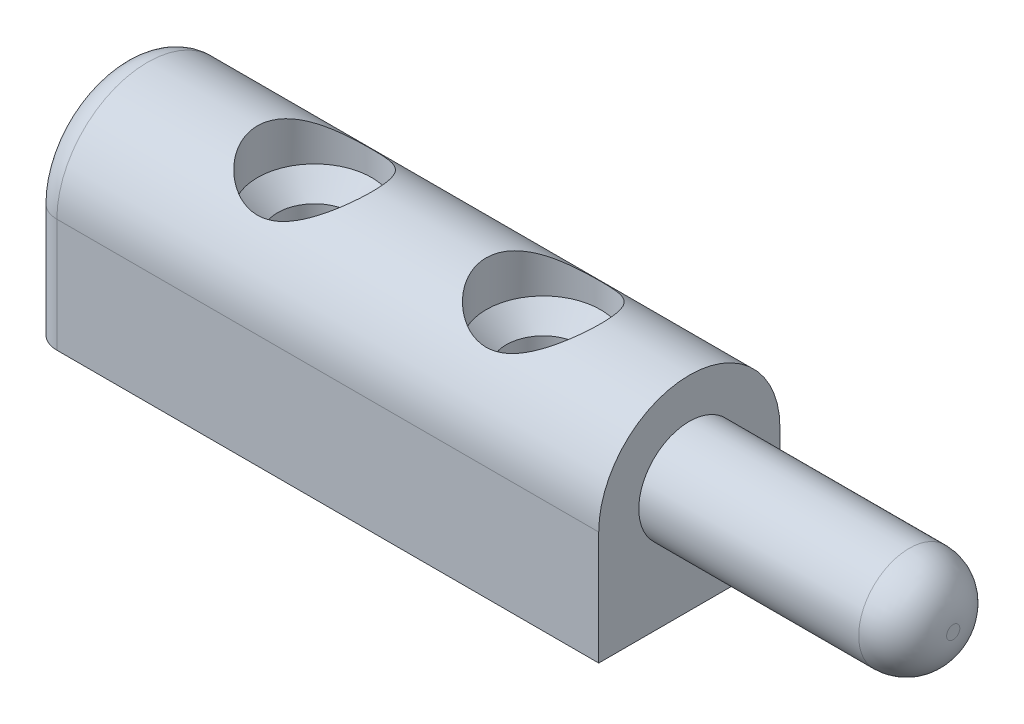
from build123d import *

# Parameters (mm, degrees)
ESBO_O1_R                = 2.95
RESSALTO_EXTRUS_O1_DEPTH = 16.15
RESSALTO_EXTRUS_O2_DEPTH = 32.3
FILETE1_R                = 1.5
ESBO_O3_R                = 3.25
CORTE_EXTRUS_O1_DEPTH    = 21.540435635
ESBO_O5_R                = 3.25
ESBO_O5_R_2              = 2.1
RESSALTO_EXTRUS_O3_DEPTH = 9.1
CHANFRO1_SIZE            = 1.2
ESBO_O7_R                = 2.875
RESSALTO_EXTRUS_O6_DEPTH = 15
FILETE2_R                = 2.5


with BuildPart() as part:
    # Esboço1 → Ressalto-extrusão1 (new, symmetric)
    with BuildSketch(Plane(origin=(0, 0, 0), x_dir=(0, 0, -1), z_dir=(1, 0, 0))):
        with BuildLine():
            Line((5.15, -6.450193796), (-5.15, -6.450193796))
            Line((-5.15, -6.450193796), (-5.15, 0))
            ThreePointArc((-5.15, 0), (0, 5.15), (5.15, 0))
            Line((5.15, 0), (5.15, -6.450193796))
        make_face()
        Circle(ESBO_O1_R, mode=Mode.SUBTRACT)
    extrude(amount=RESSALTO_EXTRUS_O1_DEPTH, both=True)

    # Esboço2 → Ressalto-extrusão2 (add, through all)
    with BuildSketch(Plane.ZY.offset(16.15)):
        with BuildLine():
            Line((-5.15, 0), (-5.15, -6.450193796))
            Line((-5.15, -6.450193796), (5.15, -6.450193796))
            Line((5.15, -6.450193796), (5.15, 0))
            ThreePointArc((5.15, 0), (0, 5.15), (-5.15, 0))
        make_face()
    extrude(amount=-RESSALTO_EXTRUS_O2_DEPTH)

    # Filete1
    filete1_edges = [part.edges().sort_by_distance(p)[0] for p in [
        (-16.15, -3.225096898, -5.15),
        (-16.15, -3.225096898, 5.15),
        (-16.15, 5.15, 0),
    ]]
    fillet(filete1_edges, radius=FILETE1_R)

    # Esboço3 → Corte-extrusão1 (cut, through all)
    with BuildSketch(Plane.XZ.offset(6.450193796)):
        with Locations(Location((-5.15, 0, 0), (0, 0, 270))):
            Circle(ESBO_O3_R)
        with Locations(Location((7.85, 0, 0), (0, 0, 270))):
            Circle(ESBO_O3_R)
    extrude(amount=-CORTE_EXTRUS_O1_DEPTH, mode=Mode.SUBTRACT)

    # Esboço5 → Ressalto-extrusão3 (add)
    # profile 1 of 2: a face of its own
    with BuildSketch(Plane.XZ.offset(6.450193796)):
        with Locations(Location((7.85, 0, 0), (0, 0, 270))):
            Circle(ESBO_O5_R)
        with Locations(Location((7.85, 0, 0), (0, 0, 270))):
            Circle(ESBO_O5_R_2, mode=Mode.SUBTRACT)
    # profile 2 of 2: a face of its own
    with BuildSketch(Plane.XZ.offset(6.450193796)):
        with Locations(Location((-5.15, 0, 0), (0, 0, 270))):
            Circle(ESBO_O5_R)
        with Locations(Location((-5.15, 0, 0), (0, 0, 270))):
            Circle(ESBO_O5_R_2, mode=Mode.SUBTRACT)
    extrude(amount=-RESSALTO_EXTRUS_O3_DEPTH)

    # Chanfro1
    # the kernel refuses this chamfer: 1.2 mm, written as the material it takes off along each edge
    with BuildSketch(Plane(origin=(-5.15, 2.649806204, 0), x_dir=(0, 0, -1), z_dir=(-1, 0, 0))) as chanfro1_piece_1_section:
        Polygon((2.1 + CHANFRO1_SIZE, 0), (2.1, CHANFRO1_SIZE), (2.1, 0), align=None)
    chanfro1_piece_1 = revolve(axis=Axis((-5.15, 2.649806204, 0), (0, -1, 0)), mode=Mode.PRIVATE)
    chanfro1_piece_1 = chanfro1_piece_1 & Plane(origin=(-5.15, 2.024165302, 0), x_dir=(0, 0, -1), z_dir=(0, -1, 0)) * Cylinder(3.25, 14, mode=Mode.PRIVATE)
    add(chanfro1_piece_1, mode=Mode.SUBTRACT)
    with BuildSketch(Plane(origin=(7.85, 2.649806204, 0), x_dir=(0, 0, -1), z_dir=(-1, 0, 0))) as chanfro1_piece_2_section:
        Polygon((2.1 + CHANFRO1_SIZE, 0), (2.1, CHANFRO1_SIZE), (2.1, 0), align=None)
    chanfro1_piece_2 = revolve(axis=Axis((7.85, 2.649806204, 0), (0, -1, 0)), mode=Mode.PRIVATE)
    chanfro1_piece_2 = chanfro1_piece_2 & Plane(origin=(7.85, 2.024165302, 0), x_dir=(0, 0, -1), z_dir=(0, -1, 0)) * Cylinder(3.25, 14, mode=Mode.PRIVATE)
    add(chanfro1_piece_2, mode=Mode.SUBTRACT)

    # Esboço7 → Ressalto-extrusão6 (add)
    with BuildSketch(Plane(origin=(16.15, 0, 0), x_dir=(0, 0, -1), z_dir=(1, 0, 0))):
        Circle(ESBO_O7_R)
    extrude(amount=RESSALTO_EXTRUS_O6_DEPTH)

    # Filete2
    filete2_edges = [part.edges().sort_by_distance(p)[0] for p in [
        (31.15, 0, 2.875),
    ]]
    fillet(filete2_edges, radius=FILETE2_R)


solid = part.part
